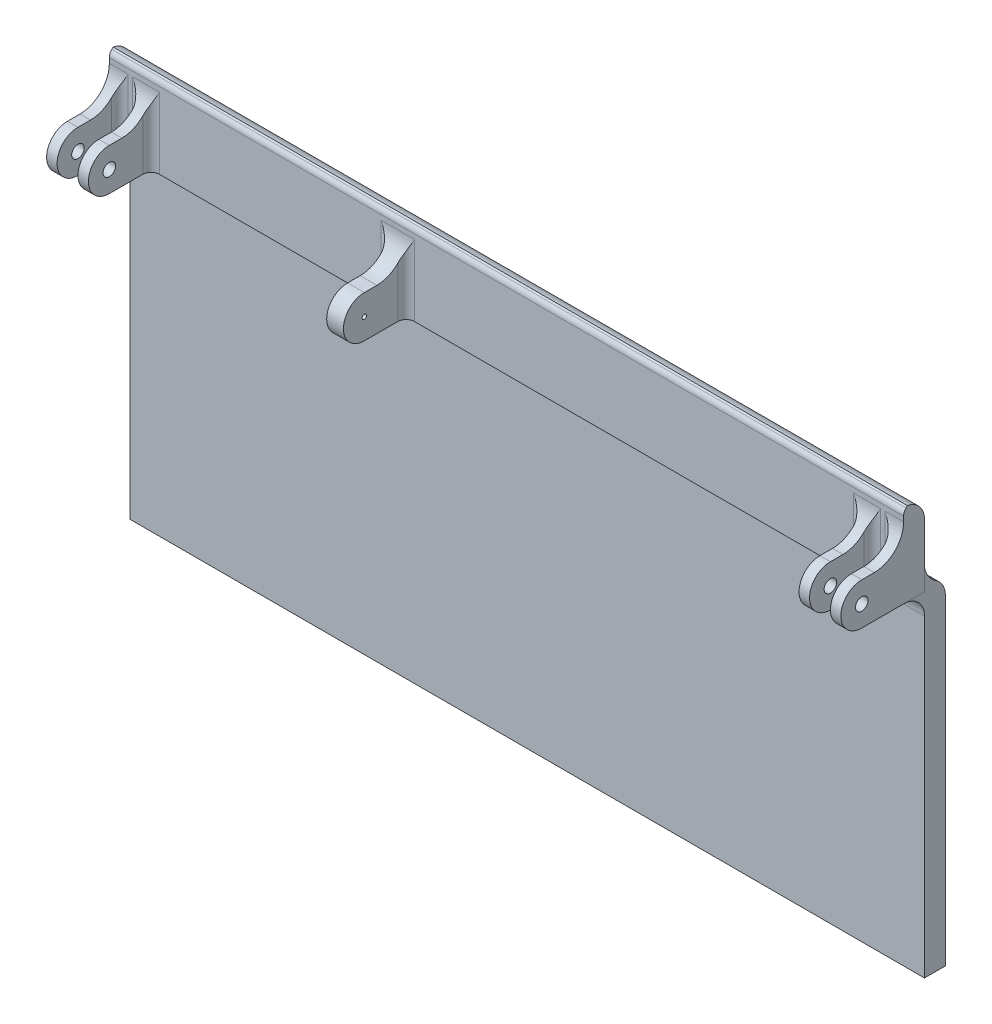
from build123d import *

# Parameters (mm, degrees)
ESQUISSE1_W        = 190
ESQUISSE1_H        = 20
BOSS_EXTRU_1_DEPTH = 5
BOSS_EXTRU_2_START = -67
ESQUISSE2_R        = 0.525
BOSS_EXTRU_2_DEPTH = 4
BOSS_EXTRU_3_DEPTH = 190
CONG_3_R           = 5
CONG_4_R           = 5
CHANFREIN1_SIZE    = 1
ESQUISSE6_R        = 1.5
BOSS_EXTRU_4_DEPTH = 2.5
BOSS_EXTRU_5_START = 5
ESQUISSE7_R        = 1.5
BOSS_EXTRU_5_DEPTH = 2.5
CONG_5_R           = 7
CONG_6_R           = 2
CONG_7_R           = 2


# Some blends are built 0.0001 mm under size
with BuildPart() as part:
    # Esquisse1 → Boss.-Extru.1 (new body)
    with BuildSketch(Plane.XY):
        Rectangle(ESQUISSE1_W, ESQUISSE1_H)
    extrude(amount=BOSS_EXTRU_1_DEPTH)

    # Esquisse2 → Boss.-Extru.2 (add)
    with BuildSketch(Plane.ZY.offset(95).offset(BOSS_EXTRU_2_START)):
        with BuildLine():
            Line((5, -10), (15, -10))
            ThreePointArc((15, -10), (20, -5), (15, 0))
            Line((15, 0), (5, 0))
            Line((5, 0), (5, -10))
        make_face()
        with Locations((15, -5)):
            Circle(ESQUISSE2_R, mode=Mode.SUBTRACT)
    extrude(amount=-BOSS_EXTRU_2_DEPTH)

    # Congé4
    cong_4_edges = [part.edges().sort_by_distance(p)[0] for p in [
        (0, 10, 0),
    ]]
    fillet(cong_4_edges, radius=CONG_4_R - 0.0001)  # a hair under: the kernel refuses the full size

    # Chanfrein1
    # the kernel refuses this chamfer: 1 mm, written as the material it takes off along each edge
    with BuildSketch(Plane(origin=(-97.571682988, 10, 5), x_dir=(0, 0.027495876610585623, -0.9996219169112968), z_dir=(1, 0, 0))) as chanfrein1_piece_1:
        Polygon((CHANFREIN1_SIZE * 0.999621916911, -CHANFREIN1_SIZE * 0.0274958766106), (-CHANFREIN1_SIZE * 0.0274958766106, -CHANFREIN1_SIZE * 0.999621916911), (0, 0), align=None)
    extrude(amount=195.143365976, mode=Mode.SUBTRACT)

    # Esquisse6 → Boss.-Extru.4 (add)
    with BuildSketch(Plane.ZY.offset(95)):
        with BuildLine():
            Line((5, 0), (5, -10))
            Line((5, -10), (15, -10))
            ThreePointArc((15, -10), (20, -5), (15, 0))
            Line((15, 0), (5, 0))
        make_face()
        with Locations((15, -5)):
            Circle(ESQUISSE6_R, mode=Mode.SUBTRACT)
    boss_extru_4 = extrude(amount=-BOSS_EXTRU_4_DEPTH)

    # Esquisse7 → Boss.-Extru.5 (add)
    with BuildSketch(Plane(origin=(-92.5, 0, 0), x_dir=(0, 0, -1), z_dir=(1, 0, 0)).offset(BOSS_EXTRU_5_START)):
        with BuildLine():
            Line((-5, 0), (-15, 0))
            ThreePointArc((-15, 0), (-20, -5), (-15, -10))
            Line((-15, -10), (-5, -10))
            Line((-5, -10), (-5, 0))
        make_face()
        with Locations(Location((-15, -5, 0), (0, 0, 180))):
            Circle(ESQUISSE7_R, mode=Mode.SUBTRACT)
    boss_extru_5 = extrude(amount=BOSS_EXTRU_5_DEPTH)

    # Symétrie2: Boss.-Extru.4, Boss.-Extru.5 across plane
    add(boss_extru_4.mirror(Plane(origin=(0, 0, 0), x_dir=(0, 0, 1), z_dir=(1, 0, 0))))
    add(boss_extru_5.mirror(Plane(origin=(0, 0, 0), x_dir=(0, 0, 1), z_dir=(1, 0, 0))))

    # Congé5
    cong_5_edges = [part.edges().sort_by_distance(p)[0] for p in [
        (-26, 0, 5),
        (-93.75, 0, 5),
        (-86.25, 0, 5),
        (93.75, 0, 5),
        (86.25, 0, 5),
    ]]
    fillet(cong_5_edges, radius=CONG_5_R)

    # Congé6
    cong_6_edges = [part.edges().sort_by_distance(p)[0] for p in [
        (-24, -1.5, 5),
        (-28, -1.5, 5),
        (-92.5, -1.5, 5),
        (-85, -1.5, 5),
        (-87.5, -1.5, 5),
        (92.5, -1.5, 5),
        (85, -1.5, 5),
        (87.5, -1.5, 5),
    ]]
    fillet(cong_6_edges, radius=CONG_6_R)

    # Congé7
    cong_7_edges = [part.edges().sort_by_distance(p)[0] for p in [
        (0, 9, 5),
    ]]
    fillet(cong_7_edges, radius=CONG_7_R)


with BuildPart() as body_2:
    # Esquisse3 → Boss.-Extru.3 (new, through all)
    with BuildSketch(Plane.ZY.offset(95)):
        with BuildLine():
            Line((5, -10), (0, -10))
            Line((0, -10), (0, -5))
            ThreePointArc((0, -5), (-1.760618077, -8.239381923), (-5, -10))
            Line((-5, -10), (-5, -90))
            Line((-5, -90), (0, -90))
            Line((0, -90), (0, -15))
            ThreePointArc((0, -15), (1.464466094, -11.464466094), (5, -10))
        make_face()
    extrude(amount=-BOSS_EXTRU_3_DEPTH)

    # Congé3
    cong_3_edges = [body_2.edges().sort_by_distance(p)[0] for p in [
        (0, -10, -5),
    ]]
    fillet(cong_3_edges, radius=CONG_3_R)


solid = Compound([part.part, body_2.part])
